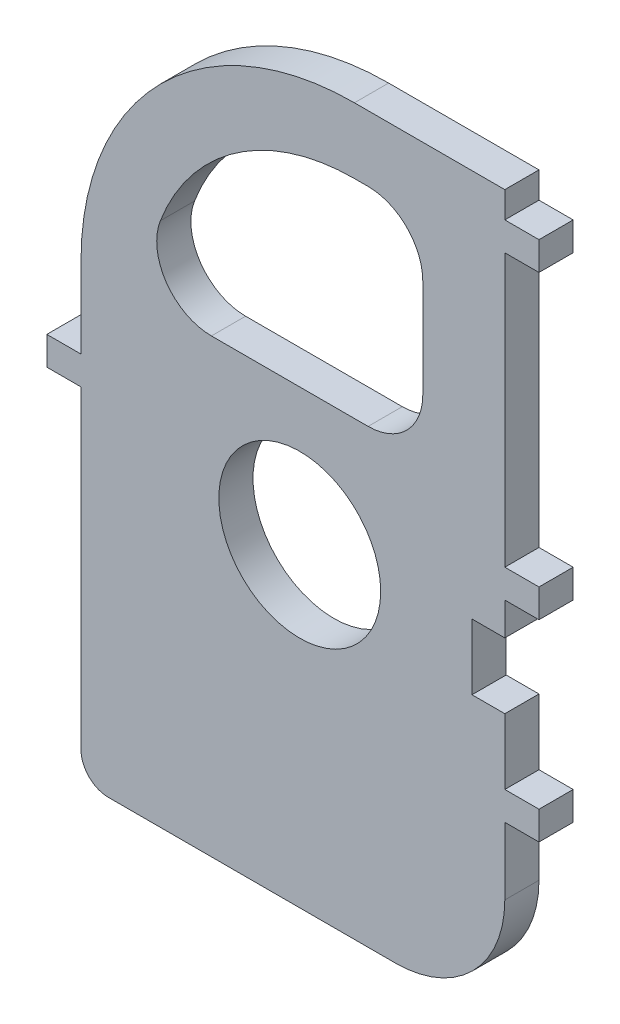
from build123d import *

# Parameters (mm, degrees)
SKETCH1_R              = 3.7592
BOSS_EXTRUDE1_DEPTH    = 1.5875
FILLET1_R              = 5.08
FILLET2_R              = 1.27
WEIGHT_REDUCTION_REACH = 24.437
FILLET3_R              = 2.54


with BuildPart() as part:
    # Sketch1 → Boss-Extrude1 (new body)
    with BuildSketch(Plane.XY):
        with BuildLine():
            Line((11.1125, 17.8308), (9.525, 17.8308))
            Line((9.525, 17.8308), (9.525, 19.05))
            Line((9.525, 19.05), (2.54, 19.05))
            ThreePointArc((2.54, 19.05), (-6.440256121, 15.330256121), (-10.16, 6.35))
            Line((-10.16, 6.35), (-10.16, 2.5908))
            Line((-10.16, 2.5908), (-11.7475, 2.5908))
            Line((-11.7475, 2.5908), (-11.7475, 1.27))
            Line((-11.7475, 1.27), (-10.16, 1.27))
            Line((-10.16, 1.27), (-10.16, -14.605))
            Line((-10.16, -14.605), (9.525, -14.605))
            Line((9.525, -14.605), (9.525, -6.4008))
            Line((9.525, -6.4008), (11.1125, -6.4008))
            Line((11.1125, -6.4008), (11.1125, -5.08))
            Line((11.1125, -5.08), (9.525, -5.08))
            Line((9.525, -5.08), (9.525, -2.032))
            Line((9.525, -2.032), (8.001, -2.032))
            Line((8.001, -2.032), (8.001, 1.016))
            Line((8.001, 1.016), (9.525, 1.016))
            Line((9.525, 1.016), (9.525, 2.54))
            Line((9.525, 2.54), (11.1125, 2.54))
            Line((11.1125, 2.54), (11.1125, 3.8608))
            Line((11.1125, 3.8608), (9.525, 3.8608))
            Line((9.525, 3.8608), (9.525, 16.51))
            Line((9.525, 16.51), (11.1125, 16.51))
            Line((11.1125, 16.51), (11.1125, 17.8308))
        make_face()
        Circle(SKETCH1_R, mode=Mode.SUBTRACT)
    extrude(amount=BOSS_EXTRUDE1_DEPTH)

    # Fillet1
    fillet1_edges = [part.edges().sort_by_distance(p)[0] for p in [
        (9.525, -14.605, 0.79375),
    ]]
    fillet(fillet1_edges, radius=FILLET1_R)

    # Fillet2
    fillet2_edges = [part.edges().sort_by_distance(p)[0] for p in [
        (-10.16, -14.605, 0.79375),
    ]]
    fillet(fillet2_edges, radius=FILLET2_R)

    # Sketch2 → Weight Reduction (cut, up to next)
    with BuildSketch(Plane.XY.offset(1.5875), mode=Mode.PRIVATE) as weight_reduction_sk1:
        with BuildLine():
            Line((-7.112, 6.35), (5.715, 6.35))
            Line((5.715, 6.35), (5.715, 16.002))
            Line((5.715, 16.002), (2.54, 16.002))
            ThreePointArc((2.54, 16.002), (-4.284994652, 13.174994652), (-7.112, 6.35))
        make_face()
    weight_reduction_tool1 = extrude(weight_reduction_sk1.sketch, amount=-WEIGHT_REDUCTION_REACH, mode=Mode.PRIVATE) & part.part
    add(weight_reduction_tool1.solids().sort_by_distance((0.121424, 10.661798, 1.5875))[0], mode=Mode.SUBTRACT)

    # Fillet3
    fillet3_edges = [part.edges().sort_by_distance(p)[0] for p in [
        (-7.112, 6.35, 0.79375),
        (5.715, 16.002, 0.79375),
        (5.715, 6.35, 0.79375),
    ]]
    fillet(fillet3_edges, radius=FILLET3_R)


solid = part.part
